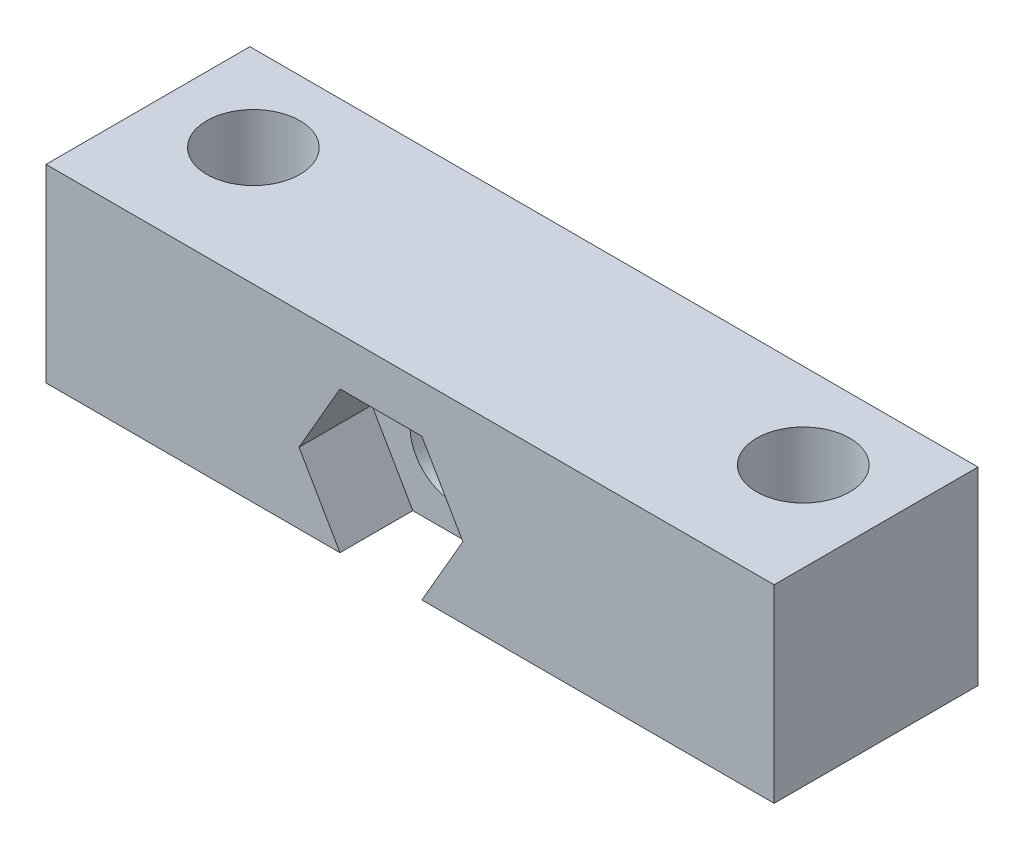
from build123d import *

# Parameters (mm, degrees)
SKETCH1_W               = 25
SKETCH1_H               = 7
SKETCH1_R               = 1.6
BOSS_EXTRUDE1_DEPTH     = 6.5
CUT_EXTRUDE1_START      = -1
SKETCH3_R               = 1.5
CUT_EXTRUDE1_DEPTH      = 15.386682553
CUT_EXTRUDE2_START      = 1
CUT_EXTRUDE2_OUTLINE_R  = 1.5
CUT_EXTRUDE2_DEPTH      = 2.5
CUT_EXTRUDE3_DEPTH      = 16.386682553
CUT_EXTRUDE3_DEPTH_BACK = 16.386682553
SKETCH3_3_R             = 1.5


# Read off the part's stored shape, not the designer's step: Cut-Extrude2
with BuildPart() as part:
    # Sketch1 → Boss-Extrude1 (new body)
    with BuildSketch(Plane(origin=(0, 0, 0), x_dir=(1, 0, 0), z_dir=(0, 1, 0))):
        with Locations((1, 0)):
            Rectangle(SKETCH1_W, SKETCH1_H)
        with Locations(Location((10.44, 0.56, 0), (0, 0, 90))):
            Circle(SKETCH1_R, mode=Mode.SUBTRACT)
        with Locations(Location((-8.44, 0.56, 0), (0, 0, 90))):
            Circle(SKETCH1_R, mode=Mode.SUBTRACT)
    extrude(amount=BOSS_EXTRUDE1_DEPTH)

    # Sketch3 → Cut-Extrude1 (cut, through all)
    with BuildSketch(Plane.XY.offset(CUT_EXTRUDE1_START)):
        Polygon((1.405847905, 0), (2.811695811, 2.435), (1.405847905, 4.87), (-1.405847905, 4.87), (-2.811695811, 2.435), (-1.405847905, 0), align=None)
        with Locations((0, 2.435)):
            Circle(SKETCH3_R, mode=Mode.SUBTRACT)
    extrude(amount=-CUT_EXTRUDE1_DEPTH, mode=Mode.SUBTRACT)

    # Cut-Extrude2 outline → Cut-Extrude2 (cut)
    with BuildSketch(Plane.XY.offset(CUT_EXTRUDE2_START)):
        Polygon((-2.811695811, 2.435), (-1.405847905, 0), (1.405847905, 0), (2.811695811, 2.435), (1.405847905, 4.87), (-1.405847905, 4.87), align=None)
        with Locations((0, 2.435)):
            Circle(CUT_EXTRUDE2_OUTLINE_R, mode=Mode.SUBTRACT)
    extrude(amount=CUT_EXTRUDE2_DEPTH, mode=Mode.SUBTRACT)

    # Sketch3<3> → Cut-Extrude3 (cut, two sides: drawn at the far end of the back side and taken through both)
    with BuildSketch(Plane.XY.offset(-CUT_EXTRUDE3_DEPTH_BACK)):
        with Locations((0, 2.435)):
            Circle(SKETCH3_3_R)
    extrude(amount=CUT_EXTRUDE3_DEPTH + CUT_EXTRUDE3_DEPTH_BACK, mode=Mode.SUBTRACT)


solid = part.part
